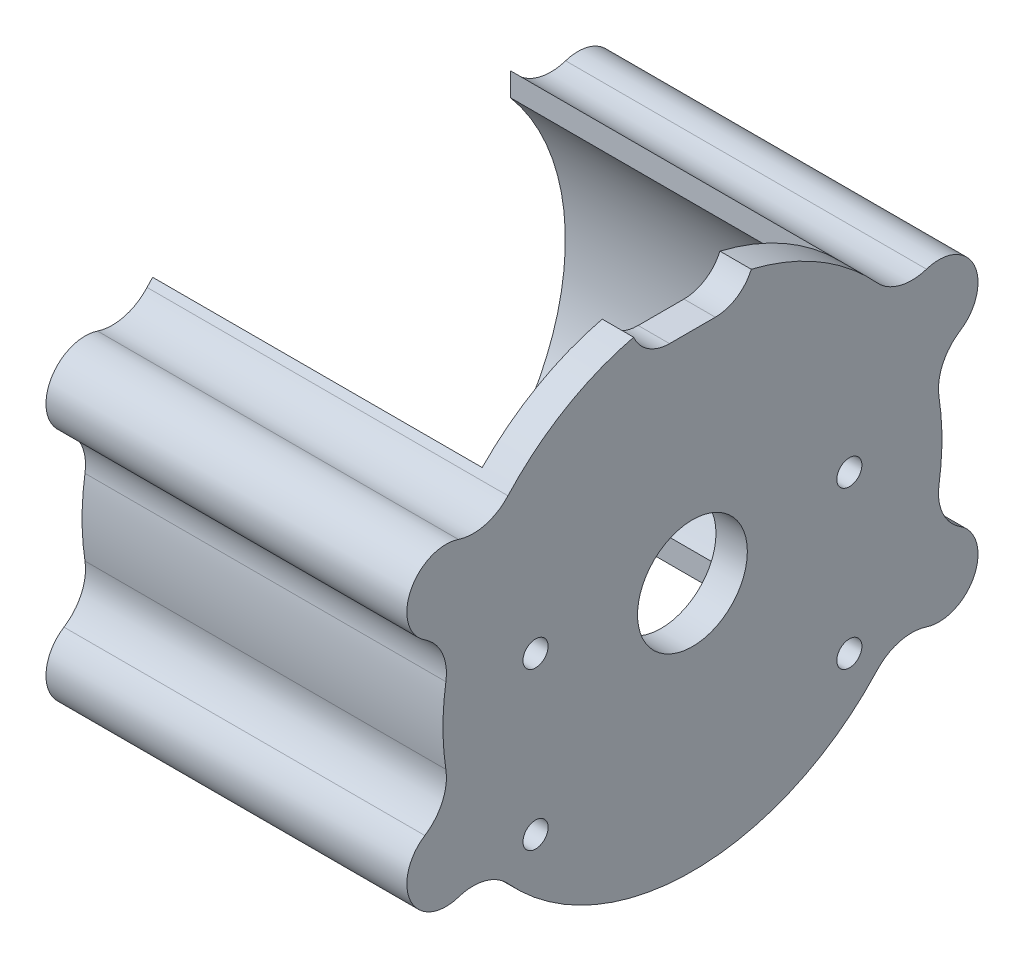
from build123d import *

# Parameters (mm, degrees)
SKETCH7_R                = 7
BOSS_EXTRUDE1_DEPTH      = 46
CUT_EXTRUDE1_START       = -46
CUT_EXTRUDE1_OUTLINE_R   = 7
CUT_EXTRUDE1_DEPTH       = 42
M3_CLEARANCE_HOLE1_D     = 3.2
M3_CLEARANCE_HOLE1_DEPTH = 5
M3_CLEARANCE_HOLE1_TIP   = 0.96137699
M3_TAPPED_HOLE1_D        = 2.5
M3_TAPPED_HOLE1_DEPTH    = 7.5
M3_TAPPED_HOLE1_TIP      = 0.751075774
FILLET1_R                = 5


# Read off the part's stored shape, not the designer's step: Cut-Extrude1
with BuildPart() as part:
    # Sketch7 → Boss-Extrude1 (new body)
    with BuildSketch(Plane(origin=(0, 0, 0), x_dir=(0, 0, -1), z_dir=(1, 0, 0))):
        with BuildLine():
            Line((-7.5, 27.902912484), (-7.5, 30.902912484))
            ThreePointArc((-7.5, 30.902912484), (-16.218584434, 27.353199428), (-23.515946886, 21.40654671))
            ThreePointArc((-23.515946886, 21.40654671), (-26.429411238, 19.642162968), (-29.833839376, 19.747962631))
            ThreePointArc((-29.833839376, 19.747962631), (-35.912951138, 17.155172414), (-34.109592252, 10.797023497))
            ThreePointArc((-34.109592252, 10.797023497), (-31.887887506, 8.215289092), (-31.429483161, 4.840205393))
            ThreePointArc((-31.429483161, 4.840205393), (-31.8, 0), (-31.429483161, -4.840205393))
            ThreePointArc((-31.429483161, -4.840205393), (-31.887887506, -8.215289092), (-34.109592252, -10.797023497))
            ThreePointArc((-34.109592252, -10.797023497), (-35.912951138, -17.155172414), (-29.833839376, -19.747962631))
            ThreePointArc((-29.833839376, -19.747962631), (-26.429411238, -19.642162968), (-23.515946886, -21.40654671))
            ThreePointArc((-23.515946886, -21.40654671), (0, -31.8), (23.515946886, -21.40654671))
            ThreePointArc((23.515946886, -21.40654671), (26.429411238, -19.642162968), (29.833839376, -19.747962631))
            ThreePointArc((29.833839376, -19.747962631), (35.912951138, -17.155172414), (34.109592252, -10.797023497))
            ThreePointArc((34.109592252, -10.797023497), (31.887887506, -8.215289092), (31.429483161, -4.840205393))
            ThreePointArc((31.429483161, -4.840205393), (31.8, 0), (31.429483161, 4.840205393))
            ThreePointArc((31.429483161, 4.840205393), (31.887887506, 8.215289092), (34.109592252, 10.797023497))
            ThreePointArc((34.109592252, 10.797023497), (35.912951138, 17.155172414), (29.833839376, 19.747962631))
            ThreePointArc((29.833839376, 19.747962631), (26.429411238, 19.642162968), (23.515946886, 21.40654671))
            ThreePointArc((23.515946886, 21.40654671), (16.218584434, 27.353199428), (7.5, 30.902912484))
            Line((7.5, 30.902912484), (7.5, 27.902912484))
            Line((7.5, 27.902912484), (-7.5, 27.902912484))
        make_face()
        Circle(SKETCH7_R, mode=Mode.SUBTRACT)
    extrude(amount=-BOSS_EXTRUDE1_DEPTH)

    # Cut-Extrude1 outline → Cut-Extrude1 (cut)
    with BuildSketch(Plane(origin=(0, 0, 0), x_dir=(0, 0, -1), z_dir=(1, 0, 0)).offset(CUT_EXTRUDE1_START)):
        with BuildLine():
            ThreePointArc((-22.8, 19.188538246), (-29.8, 0), (-22.8, -19.188538246))
            Line((-22.8, -19.188538246), (-22.8, -22.167543842))
            ThreePointArc((-22.8, -22.167543842), (0, -31.8), (22.8, -22.167543842))
            Line((22.8, -22.167543842), (22.8, -19.188538246))
            ThreePointArc((22.8, -19.188538246), (29.8, 0), (22.8, 19.188538246))
            Line((22.8, 19.188538246), (22.8, 22.167543842))
            ThreePointArc((22.8, 22.167543842), (15.767027822, 27.615952521), (7.5, 30.902912484))
            Line((7.5, 30.902912484), (7.5, 27.902912484))
            Line((7.5, 27.902912484), (-7.5, 27.902912484))
            Line((-7.5, 27.902912484), (-7.5, 30.902912484))
            ThreePointArc((-7.5, 30.902912484), (-15.767027822, 27.615952521), (-22.8, 22.167543842))
            Line((-22.8, 22.167543842), (-22.8, 19.188538246))
        make_face()
        Circle(CUT_EXTRUDE1_OUTLINE_R, mode=Mode.SUBTRACT)
    extrude(amount=CUT_EXTRUDE1_DEPTH, mode=Mode.SUBTRACT)

    # M3 Clearance Hole1
    with Locations(Plane(origin=(0, 0, 0), x_dir=(0, 0, -1), z_dir=(1, 0, 0))):
        with Locations((-20, 2.25), (20, 2.25), (20, -17.75), (-20, -17.75)):
            Hole(M3_CLEARANCE_HOLE1_D / 2, depth=M3_CLEARANCE_HOLE1_DEPTH)
            with Locations((0, 0, -(M3_CLEARANCE_HOLE1_DEPTH + M3_CLEARANCE_HOLE1_TIP / 2))):  # 118° drill point
                Cone(0, M3_CLEARANCE_HOLE1_D / 2, M3_CLEARANCE_HOLE1_TIP, mode=Mode.SUBTRACT)

    # M3 Tapped Hole1
    with Locations(Plane.ZY.offset(46)):
        with Locations((-31.40127386, 15), (-31.40127386, -15), (31.40127386, -15), (31.40127386, 15)):
            Hole(M3_TAPPED_HOLE1_D / 2, depth=M3_TAPPED_HOLE1_DEPTH)
            with Locations((0, 0, -(M3_TAPPED_HOLE1_DEPTH + M3_TAPPED_HOLE1_TIP / 2))):  # 118° drill point
                Cone(0, M3_TAPPED_HOLE1_D / 2, M3_TAPPED_HOLE1_TIP, mode=Mode.SUBTRACT)

    # Fillet1
    # the kernel refuses this fillet: 5 mm, written as the material it adds along each edge
    with BuildSketch(Plane(origin=(0, 27.902912484, 7.5), x_dir=(0, 0, -1), z_dir=(-1, 0, 0))) as fillet1_piece_1:
        with BuildLine():
            CenterArc((4.582575695, -5), FILLET1_R, 90, 66.421821522)
            Line((0, -3), (-0.091651514, -2.96))
            ThreePointArc((-0.091651514, -2.96), (-0.1, -1.5), (-0.1, 0))
            Line((-0.1, 0), (0, 0.1))
            Line((0, 0.1), (4.582575695, 0.1))
            Line((4.582575695, 0.1), (4.582575695, 0))
        make_face()
    extrude(amount=4)
    with BuildSketch(Plane(origin=(0, 27.902912484, -7.5), x_dir=(0, 1, 0), z_dir=(-1, 0, 0))) as fillet1_piece_2:
        with BuildLine():
            CenterArc((5, -4.582575695), FILLET1_R, 113.578178478, 66.421821522)
            Line((0, -4.582575695), (-0.1, -4.582575695))
            Line((-0.1, -4.582575695), (-0.1, 0))
            Line((-0.1, 0), (0, 0.1))
            ThreePointArc((0, 0.1), (1.5, 0.1), (2.96, 0.091651514))
            Line((2.96, 0.091651514), (3, 0))
        make_face()
    extrude(amount=4)


solid = part.part
